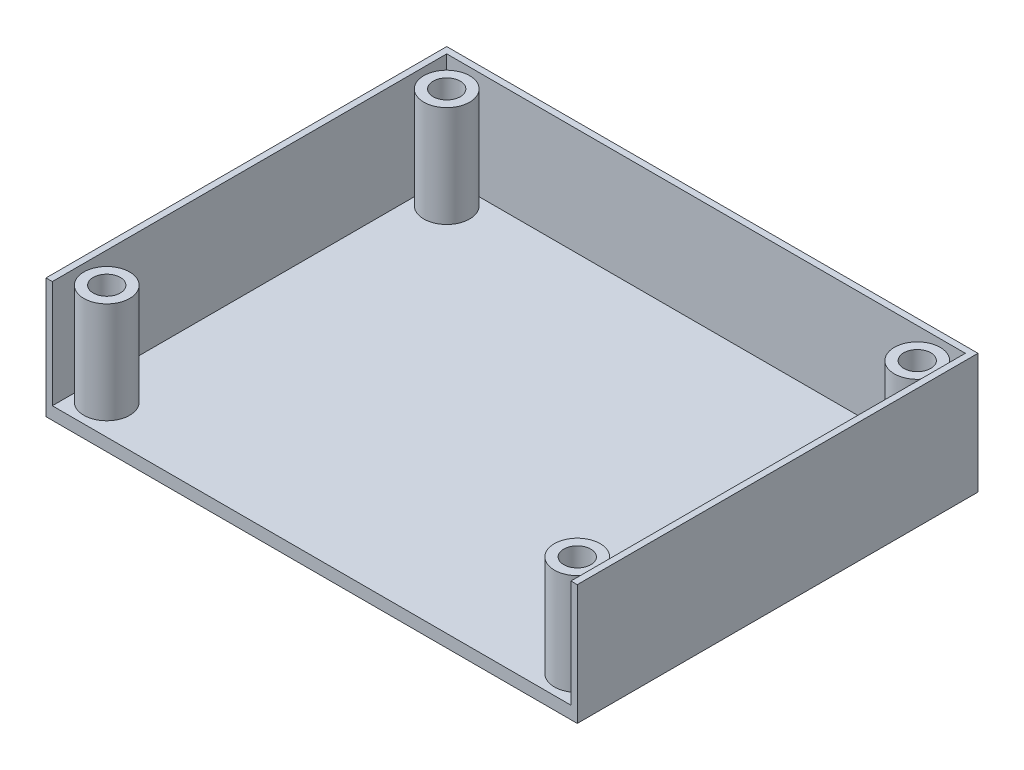
from build123d import *

# Parameters (mm, degrees)
BOSS_EXTRUDE12_DEPTH = 3.175
BOSS_EXTRUDE13_DEPTH = 30.1625
SKETCH1_25_R         = 5.75
SKETCH1_25_R_2       = 3.4
BOSS_EXTRUDE15_DEPTH = 28.575
SKETCH1_27_R         = 3.4
CUT_EXTRUDE3_DEPTH   = 28.575
CHAMFER2_SIZE        = 1.45


with BuildPart() as part:
    # Sketch1 → Boss-Extrude12 (new body)
    with BuildSketch(Plane(origin=(0, 0, 0), x_dir=(1, 0, 0), z_dir=(0, 1, 0))):
        Polygon((-66.858315384, -50.276221126), (-65.270815384, -50.276221126), (64.85543465, -50.276221126), (66.44293465, -50.276221126), (66.44293465, 50.266274766), (-66.858315384, 50.266274766), align=None)
    extrude(amount=BOSS_EXTRUDE12_DEPTH)

    # Sketch1<23> → Boss-Extrude13 (add)
    with BuildSketch(Plane(origin=(0, 0, 0), x_dir=(1, 0, 0), z_dir=(0, 1, 0))):
        Polygon((-66.858315384, 50.266274766), (-66.858315384, -50.276221126), (-65.270815384, -50.276221126), (-65.270815384, 48.678774766), (64.85543465, 48.678774766), (64.85543465, -50.276221126), (66.44293465, -50.276221126), (66.44293465, 50.266274766), align=None)
    extrude(amount=BOSS_EXTRUDE13_DEPTH)

    # Sketch1<25> → Boss-Extrude15 (add)
    # profile 1 of 4: a face of its own
    with BuildSketch(Plane(origin=(0, 0, 0), x_dir=(1, 0, 0), z_dir=(0, 1, 0))):
        with Locations((-59.238315384, 42.646274766)):
            Circle(SKETCH1_25_R)
        with Locations((-59.238315384, 42.646274766)):
            Circle(SKETCH1_25_R_2, mode=Mode.SUBTRACT)
    # profile 2 of 4: a face of its own
    with BuildSketch(Plane(origin=(0, 0, 0), x_dir=(1, 0, 0), z_dir=(0, 1, 0))):
        with Locations((58.82293465, 42.646274766)):
            Circle(SKETCH1_25_R)
        with Locations((58.82293465, 42.646274766)):
            Circle(SKETCH1_25_R_2, mode=Mode.SUBTRACT)
    # profile 3 of 4: a face of its own
    with BuildSketch(Plane(origin=(0, 0, 0), x_dir=(1, 0, 0), z_dir=(0, 1, 0))):
        with Locations((-59.238315384, -42.656221126)):
            Circle(SKETCH1_25_R)
        with Locations((-59.238315384, -42.656221126)):
            Circle(SKETCH1_25_R_2, mode=Mode.SUBTRACT)
    # profile 4 of 4: a face of its own
    with BuildSketch(Plane(origin=(0, 0, 0), x_dir=(1, 0, 0), z_dir=(0, 1, 0))):
        with Locations((58.82293465, -42.656221126)):
            Circle(SKETCH1_25_R)
        with Locations((58.82293465, -42.656221126)):
            Circle(SKETCH1_25_R_2, mode=Mode.SUBTRACT)
    extrude(amount=BOSS_EXTRUDE15_DEPTH)

    # Sketch1<27> → Cut-Extrude3 (cut)
    with BuildSketch(Plane(origin=(0, 0, 0), x_dir=(1, 0, 0), z_dir=(0, 1, 0))):
        with Locations((-59.238315384, 42.646274766)):
            Circle(SKETCH1_27_R)
        with Locations((58.82293465, 42.646274766)):
            Circle(SKETCH1_27_R)
        with Locations((-59.238315384, -42.656221126)):
            Circle(SKETCH1_27_R)
        with Locations((58.82293465, -42.656221126)):
            Circle(SKETCH1_27_R)
    extrude(amount=CUT_EXTRUDE3_DEPTH, mode=Mode.SUBTRACT)

    # Chamfer2
    chamfer2_edges = [part.edges().sort_by_distance(p)[0] for p in [
        (55.42293465, 0, 42.656221126),
        (55.42293465, 0, -42.646274766),
        (-62.638315384, 0, 42.656221126),
        (-62.638315384, 0, -42.646274766),
    ]]
    chamfer(chamfer2_edges, length=CHAMFER2_SIZE)


solid = part.part
